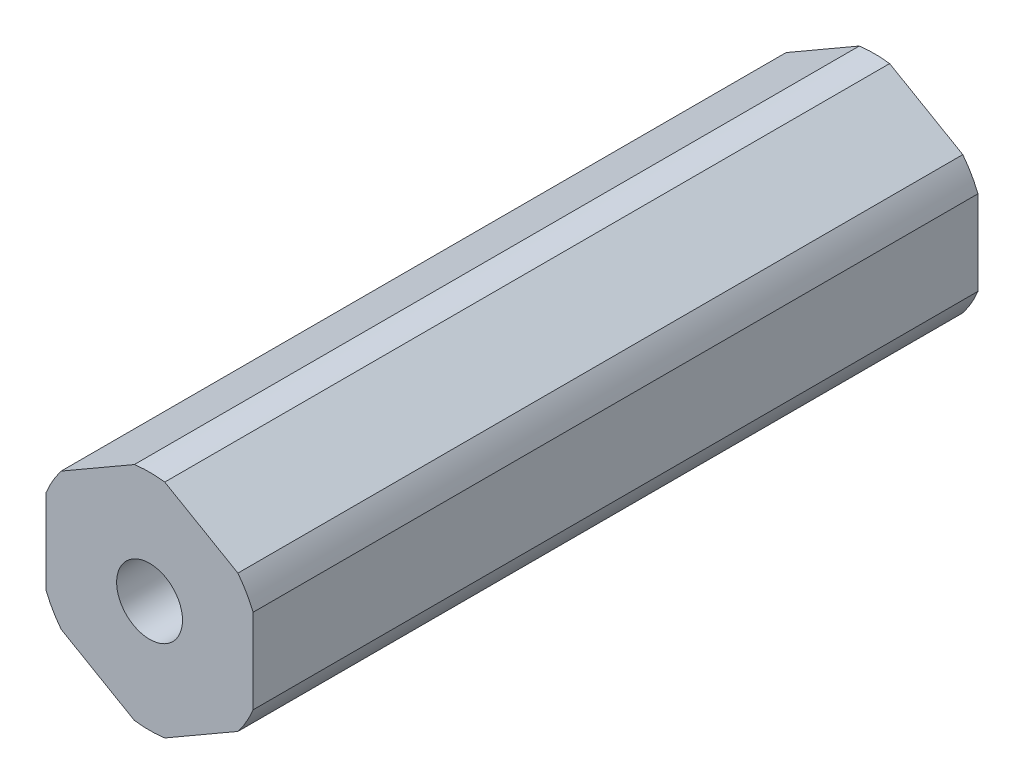
from build123d import *

# Parameters (mm, degrees)
BOSS_EXTRUDE1_DEPTH = 22.225
SKETCH2_R           = 2.0193
CUT_EXTRUDE1_DEPTH  = 46.421989873


with BuildPart() as part:
    # Sketch1 → Boss-Extrude1 (new, symmetric)
    with BuildSketch(Plane.XY):
        with BuildLine():
            ThreePointArc((0.93173274, 6.79441227), (0, 6.858), (-0.93173274, 6.79441227))
            Line((-0.93173274, 6.79441227), (-5.41826726, 4.204110358))
            ThreePointArc((-5.41826726, 4.204110358), (-5.939202219, 3.429), (-6.35, 2.590301913))
            Line((-6.35, 2.590301913), (-6.35, -2.590301913))
            ThreePointArc((-6.35, -2.590301913), (-5.939202219, -3.429), (-5.41826726, -4.204110358))
            Line((-5.41826726, -4.204110358), (-0.93173274, -6.79441227))
            ThreePointArc((-0.93173274, -6.79441227), (0, -6.858), (0.93173274, -6.79441227))
            Line((0.93173274, -6.79441227), (5.41826726, -4.204110358))
            ThreePointArc((5.41826726, -4.204110358), (5.939202219, -3.429), (6.35, -2.590301913))
            Line((6.35, -2.590301913), (6.35, 2.590301913))
            ThreePointArc((6.35, 2.590301913), (5.939202219, 3.429), (5.41826726, 4.204110358))
            Line((5.41826726, 4.204110358), (0.93173274, 6.79441227))
        make_face()
    extrude(amount=BOSS_EXTRUDE1_DEPTH, both=True)

    # Sketch2 → Cut-Extrude1 (cut, through all)
    with BuildSketch(Plane.XY.offset(22.225)):
        Circle(SKETCH2_R)
    extrude(amount=-CUT_EXTRUDE1_DEPTH, mode=Mode.SUBTRACT)


solid = part.part
